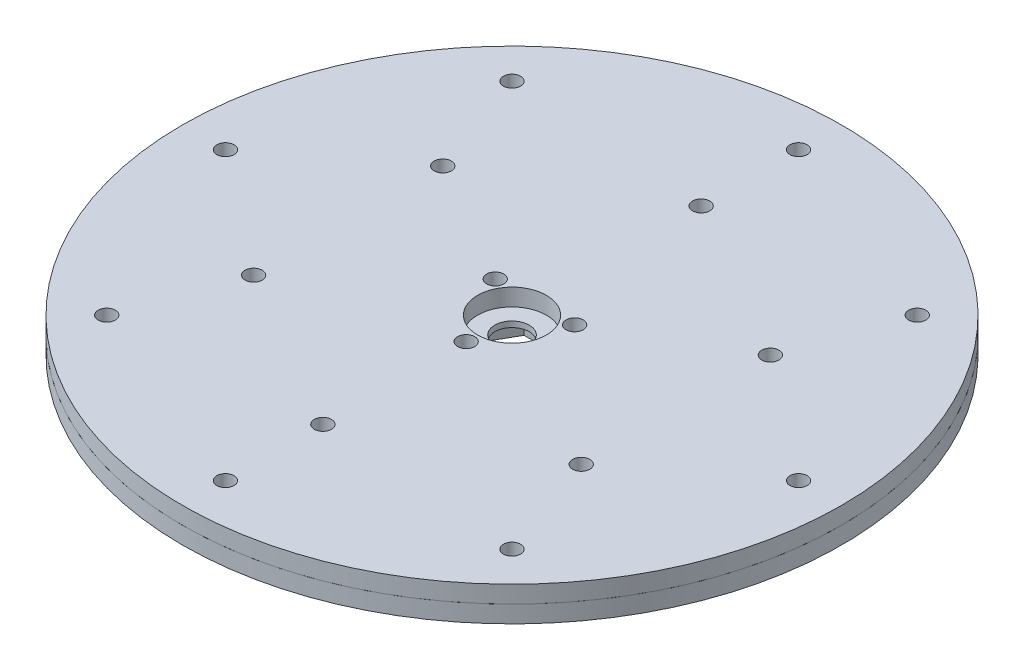
from build123d import *

# Parameters (mm, degrees)
DELETEFACE1_OUTLINE_R   = 57.5
DELETEFACE1_DEPTH       = 2
SKETCH2_R               = 57.5
SKETCH2_R_2             = 35
BOSS_EXTRUDE1_DEPTH     = 3
SKETCH3_R               = 1.5
CUT_EXTRUDE1_DEPTH      = 82.470853684
MOVE_FACE1_BY           = 1
SKETCH5_R               = 1.5
SKETCH5_R_2             = 6
CUT_EXTRUDE3_DEPTH      = 82.538334543
SKETCH6_R               = 11
SKETCH6_R_2             = 1.5
BOSS_EXTRUDE2_DEPTH     = 3
SKETCH7_R               = 11
SKETCH7_R_2             = 3
SKETCH7_R_3             = 1.5
BOSS_EXTRUDE3_DEPTH     = 1
CUT_EXTRUDE4_DEPTH      = 82.618012718
CUT_EXTRUDE4_DEPTH_BACK = 82.618012718
SKETCH8_R               = 1.5


with BuildPart() as part:
    # DeleteFace1: read off the stored shape, not the designer's step
    # DeleteFace1 outline → DeleteFace1 (new body)
    with BuildSketch(Plane(origin=(0, 0, 0), x_dir=(1, 0, 0), z_dir=(0, 1, 0))):
        Circle(DELETEFACE1_OUTLINE_R)
    extrude(amount=DELETEFACE1_DEPTH)


with BuildPart() as body_2:
    # Sketch2 → Boss-Extrude1 (new body)
    with BuildSketch(Plane.XZ):
        with Locations(Location((0, 0, 0), (0, 0, 270))):
            Circle(SKETCH2_R)
        with Locations(Location((0, 0, 0), (0, 0, 270))):
            Circle(SKETCH2_R_2, mode=Mode.SUBTRACT)
    extrude(amount=BOSS_EXTRUDE1_DEPTH)


with BuildPart() as cut_extrude1_tool:
    # Sketch3 → Cut-Extrude1 (new, through all)
    with BuildSketch(Plane(origin=(0, 2, 0), x_dir=(1, 0, 0), z_dir=(0, 1, 0))):
        with Locations(Location((35.355339059, 35.355339059, 0), (0, 0, 270))):
            Circle(SKETCH3_R)
        with Locations(Location((50, 0, 0), (0, 0, 270))):
            Circle(SKETCH3_R)
        with Locations(Location((35.355339059, -35.355339059, 0), (0, 0, 270))):
            Circle(SKETCH3_R)
        with Locations(Location((0, -50, 0), (0, 0, 270))):
            Circle(SKETCH3_R)
        with Locations(Location((-35.355339059, -35.355339059, 0), (0, 0, 270))):
            Circle(SKETCH3_R)
        with Locations(Location((-50, 0, 0), (0, 0, 270))):
            Circle(SKETCH3_R)
        with Locations(Location((0, 50, 0), (0, 0, 270))):
            Circle(SKETCH3_R)
        with Locations(Location((-35.355339059, 35.355339059, 0), (0, 0, 270))):
            Circle(SKETCH3_R)
    extrude(amount=-CUT_EXTRUDE1_DEPTH)


with BuildPart() as part_1:
    add(part.part)

    # Cut-Extrude1: cut by cut_extrude1_tool
    add(cut_extrude1_tool.part, mode=Mode.SUBTRACT)

    # Move Face1: a face moved outward by 1.0
    extrude(part_1.faces().sort_by_distance((0, 2, 0))[0], amount=MOVE_FACE1_BY, dir=(0, 1, 0))

    # Sketch5 → Cut-Extrude3 (cut, through all)
    with BuildSketch(Plane(origin=(0, 3, 0), x_dir=(1, 0, 0), z_dir=(0, 1, 0))):
        with Locations(Location((0, 33, 0), (0, 0, 270))):
            Circle(SKETCH5_R)
        with Locations(Location((28.578838325, 16.5, 0), (0, 0, 270))):
            Circle(SKETCH5_R)
        with Locations(Location((28.578838325, -16.5, 0), (0, 0, 270))):
            Circle(SKETCH5_R)
        with Locations(Location((0, -33, 0), (0, 0, 270))):
            Circle(SKETCH5_R)
        with Locations(Location((-28.578838325, -16.5, 0), (0, 0, 270))):
            Circle(SKETCH5_R)
        with Locations(Location((-28.578838325, 16.5, 0), (0, 0, 270))):
            Circle(SKETCH5_R)
        with Locations(Location((0, 0, 0), (0, 0, 270))):
            Circle(SKETCH5_R_2)
    extrude(amount=-CUT_EXTRUDE3_DEPTH, mode=Mode.SUBTRACT)

    # Sketch8 → Cut-Extrude4 (cut, two sides: drawn at the far end of the back side and taken through both)
    with BuildSketch(Plane.XZ.offset(4).offset(-CUT_EXTRUDE4_DEPTH_BACK)):
        with Locations(Location((6.92820323, -4, 0), (0, 0, 270))):
            Circle(SKETCH8_R)
        with Locations(Location((-6.92820323, -4, 0), (0, 0, 270))):
            Circle(SKETCH8_R)
        with Locations(Location((0, 8, 0), (0, 0, 270))):
            Circle(SKETCH8_R)
    extrude(amount=CUT_EXTRUDE4_DEPTH + CUT_EXTRUDE4_DEPTH_BACK, mode=Mode.SUBTRACT)


with BuildPart() as body_2_1:
    add(body_2.part)

    # Cut-Extrude1: cut by cut_extrude1_tool
    add(cut_extrude1_tool.part, mode=Mode.SUBTRACT)


with BuildPart() as body_3:
    # Sketch6 → Boss-Extrude2 (new body)
    with BuildSketch(Plane.XZ):
        with Locations(Location((0, 0, 0), (0, 0, 270))):
            Circle(SKETCH6_R)
        with Locations(Location((0, 8, 0), (0, 0, 270))):
            Circle(SKETCH6_R_2, mode=Mode.SUBTRACT)
        with Locations(Location((6.92820323, -4, 0), (0, 0, 270))):
            Circle(SKETCH6_R_2, mode=Mode.SUBTRACT)
        with Locations(Location((-6.92820323, -4, 0), (0, 0, 270))):
            Circle(SKETCH6_R_2, mode=Mode.SUBTRACT)
        Polygon((-2.886751346, 5), (-5.773502692, 0), (-2.886751346, -5), (2.886751346, -5), (5.773502692, 0), (2.886751346, 5), align=None, mode=Mode.SUBTRACT)
    extrude(amount=BOSS_EXTRUDE2_DEPTH)


with BuildPart() as body_4:
    # Sketch7 → Boss-Extrude3 (new body)
    with BuildSketch(Plane.XZ):
        with Locations(Location((0, 0, 0), (0, 0, 270))):
            Circle(SKETCH7_R)
        with Locations(Location((0, 0, 0), (0, 0, 270))):
            Circle(SKETCH7_R_2, mode=Mode.SUBTRACT)
        with Locations(Location((6.92820323, -4, 0), (0, 0, 270))):
            Circle(SKETCH7_R_3, mode=Mode.SUBTRACT)
        with Locations(Location((0, 8, 0), (0, 0, 270))):
            Circle(SKETCH7_R_3, mode=Mode.SUBTRACT)
        with Locations(Location((-6.92820323, -4, 0), (0, 0, 270))):
            Circle(SKETCH7_R_3, mode=Mode.SUBTRACT)
    extrude(amount=BOSS_EXTRUDE3_DEPTH)


with BuildPart() as body_3_1:
    # Body-Move/Copy1: moved
    add(body_3.part.moved(Location((0, -1, 0))))


solid = Compound([part_1.part, body_2_1.part, body_4.part, body_3_1.part])
